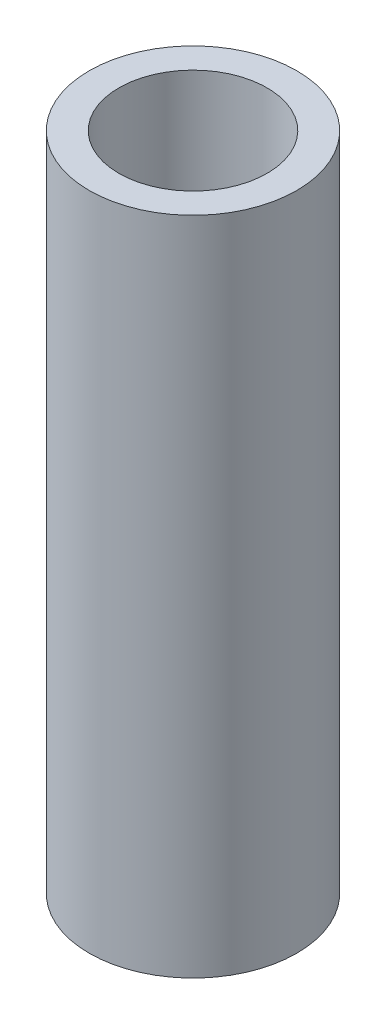
from build123d import *

# Parameters (mm, degrees)
SKETCH1_R           = 2.2225
SKETCH1_R_2         = 1.5875
BOSS_EXTRUDE1_DEPTH = 14.15034


with BuildPart() as part:
    # Sketch1 → Boss-Extrude1 (new body)
    with BuildSketch(Plane(origin=(0, 0, 0), x_dir=(1, 0, 0), z_dir=(0, 1, 0))):
        Circle(SKETCH1_R)
        Circle(SKETCH1_R_2, mode=Mode.SUBTRACT)
    extrude(amount=BOSS_EXTRUDE1_DEPTH)


solid = part.part
